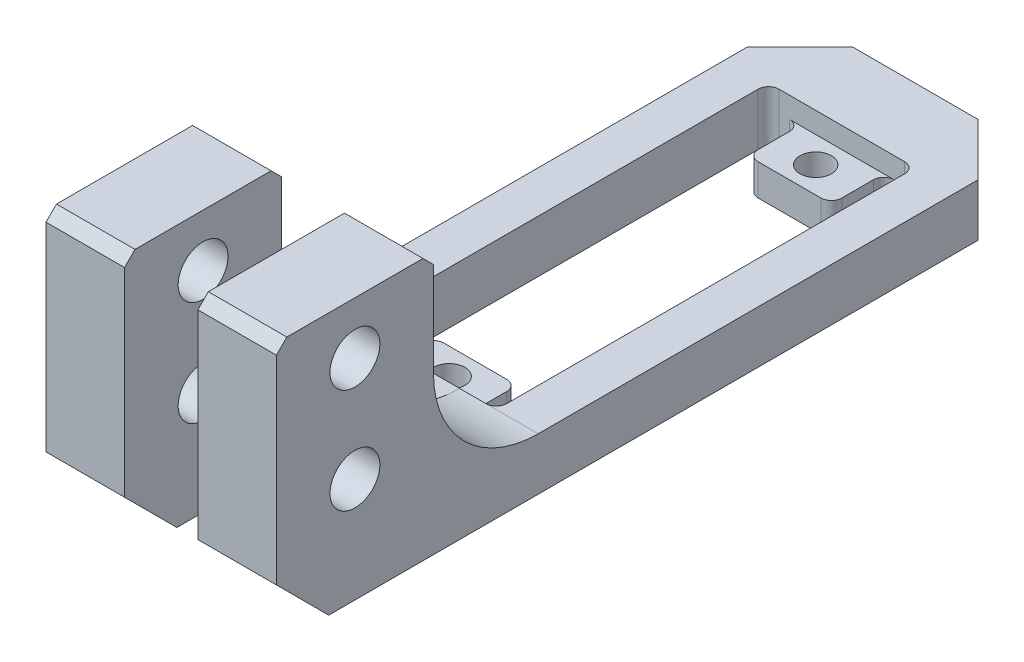
from build123d import *

# Parameters (mm, degrees)
SKETCH1_W           = 22
SKETCH1_H           = 72
BOSS_EXTRUDE2_DEPTH = 5
SKETCH2_W           = 14
SKETCH2_H           = 30
CUT_EXTRUDE1_DEPTH  = 38.973675092
SKETCH3_W           = 3
SKETCH3_H           = 5
CUT_EXTRUDE2_DEPTH  = 38.973675092
SKETCH4_R           = 1.5
CUT_EXTRUDE3_DEPTH  = 38.973675092
SKETCH5_W           = 7.5
SKETCH5_H           = 15
BOSS_EXTRUDE3_DEPTH = 20
CHAMFER2_SIZE       = 5
SKETCH6_W           = 7
SKETCH6_H           = 15
CUT_EXTRUDE4_DEPTH  = 43.626282972
SKETCH7_W           = 8
SKETCH7_H           = 5
CUT_EXTRUDE5_DEPTH  = 2
CHAMFER6_SIZE       = 5
FILLET3_R           = 1
FILLET6_R           = 10
SKETCH9_R           = 2.38125
CUT_EXTRUDE6_DEPTH  = 50.040799341
CHAMFER8_SIZE       = 1


with BuildPart() as part:
    # Sketch1 → Boss-Extrude2 (new body)
    with BuildSketch(Plane(origin=(0, 0, 0), x_dir=(1, 0, 0), z_dir=(0, 1, 0))):
        Rectangle(SKETCH1_W, SKETCH1_H)
    extrude(amount=BOSS_EXTRUDE2_DEPTH)

    # Sketch2 → Cut-Extrude1 (cut, through all)
    with BuildSketch(Plane(origin=(0, 5, 0), x_dir=(1, 0, 0), z_dir=(0, 1, 0))):
        with Locations((0, 9)):
            Rectangle(SKETCH2_W, SKETCH2_H)
    extrude(amount=-CUT_EXTRUDE1_DEPTH, mode=Mode.SUBTRACT)

    # Sketch3 → Cut-Extrude2 (cut, through all)
    with BuildSketch(Plane(origin=(0, 5, 0), x_dir=(1, 0, 0), z_dir=(0, 1, 0))):
        with Locations((-5.5, 26.5)):
            Rectangle(SKETCH3_W, SKETCH3_H)
        with Locations((5.5, 26.5)):
            Rectangle(SKETCH3_W, SKETCH3_H)
        with Locations((-5.5, -8.5)):
            Rectangle(SKETCH3_W, SKETCH3_H)
        with Locations((5.5, -8.5)):
            Rectangle(SKETCH3_W, SKETCH3_H)
    extrude(amount=-CUT_EXTRUDE2_DEPTH, mode=Mode.SUBTRACT)

    # Sketch4 → Cut-Extrude3 (cut, through all)
    with BuildSketch(Plane(origin=(0, 5, 0), x_dir=(1, 0, 0), z_dir=(0, 1, 0))):
        with Locations(Location((0, 26.5, 0), (0, 0, 270))):
            Circle(SKETCH4_R)
        with Locations(Location((0, -8.5, 0), (0, 0, 270))):
            Circle(SKETCH4_R)
    extrude(amount=-CUT_EXTRUDE3_DEPTH, mode=Mode.SUBTRACT)

    # Sketch5 → Boss-Extrude3 (add)
    with BuildSketch(Plane(origin=(0, 5, 0), x_dir=(1, 0, 0), z_dir=(0, 1, 0))):
        with Locations((-7.25, -28.5)):
            Rectangle(SKETCH5_W, SKETCH5_H)
    boss_extrude3 = extrude(amount=BOSS_EXTRUDE3_DEPTH)

    # Mirror1: Boss-Extrude3 across plane
    add(boss_extrude3.mirror(Plane(origin=(0, 0, 0), x_dir=(0, 0, 1), z_dir=(1, 0, 0))))

    # Chamfer2
    chamfer2_edges = [part.edges().sort_by_distance(p)[0] for p in [
        (0, 0, 36),
    ]]
    chamfer(chamfer2_edges, length=CHAMFER2_SIZE - 0.0001)  # a hair under: the kernel refuses the full size

    # Sketch6 → Cut-Extrude4 (cut, through all)
    with BuildSketch(Plane(origin=(0, 5, 0), x_dir=(1, 0, 0), z_dir=(0, 1, 0))):
        with Locations((0, -28.5)):
            Rectangle(SKETCH6_W, SKETCH6_H)
    extrude(amount=-CUT_EXTRUDE4_DEPTH, mode=Mode.SUBTRACT)

    # Sketch7 → Cut-Extrude5 (cut)
    with BuildSketch(Plane(origin=(0, 5, 0), x_dir=(1, 0, 0), z_dir=(0, 1, 0))):
        with Locations((0, 26.5)):
            Rectangle(SKETCH7_W, SKETCH7_H)
        with Locations((0, -8.5)):
            Rectangle(SKETCH7_W, SKETCH7_H)
    extrude(amount=-CUT_EXTRUDE5_DEPTH, mode=Mode.SUBTRACT)

    # Chamfer6
    chamfer6_edges = [part.edges().sort_by_distance(p)[0] for p in [
        (-11, 2.5, -36),
        (11, 2.5, -36),
    ]]
    chamfer(chamfer6_edges, length=CHAMFER6_SIZE)

    # Fillet3
    fillet3_edges = [part.edges().sort_by_distance(p)[0] for p in [
        (-7, 2.5, -29),
        (-4, 1.5, -29),
        (-4, 1.5, -24),
        (7, 2.5, -29),
        (4, 1.5, -24),
        (4, 1.5, -29),
        (-7, 2.5, 11),
        (-4, 1.5, 6),
        (-4, 1.5, 11),
        (7, 2.5, 11),
        (4, 1.5, 11),
        (4, 1.5, 6),
    ]]
    fillet(fillet3_edges, radius=FILLET3_R)

    # Fillet6
    fillet6_edges = [part.edges().sort_by_distance(p)[0] for p in [
        (-7.25, 5, 21),
        (7.25, 5, 21),
    ]]
    fillet(fillet6_edges, radius=FILLET6_R - 0.0001)  # a hair under: the kernel refuses the full size

    # Sketch9 → Cut-Extrude6 (cut, through all)
    with BuildSketch(Plane.ZY.offset(11)):
        with Locations((28.5, 20)):
            Circle(SKETCH9_R)
        with Locations((28.5, 10)):
            Circle(SKETCH9_R)
    extrude(amount=-CUT_EXTRUDE6_DEPTH, mode=Mode.SUBTRACT)

    # Chamfer8
    chamfer8_edges = [part.edges().sort_by_distance(p)[0] for p in [
        (-7.25, 25, 36),
        (-7.25, 25, 21),
        (7.25, 25, 21),
        (7.25, 25, 36),
    ]]
    chamfer(chamfer8_edges, length=CHAMFER8_SIZE)


solid = part.part
